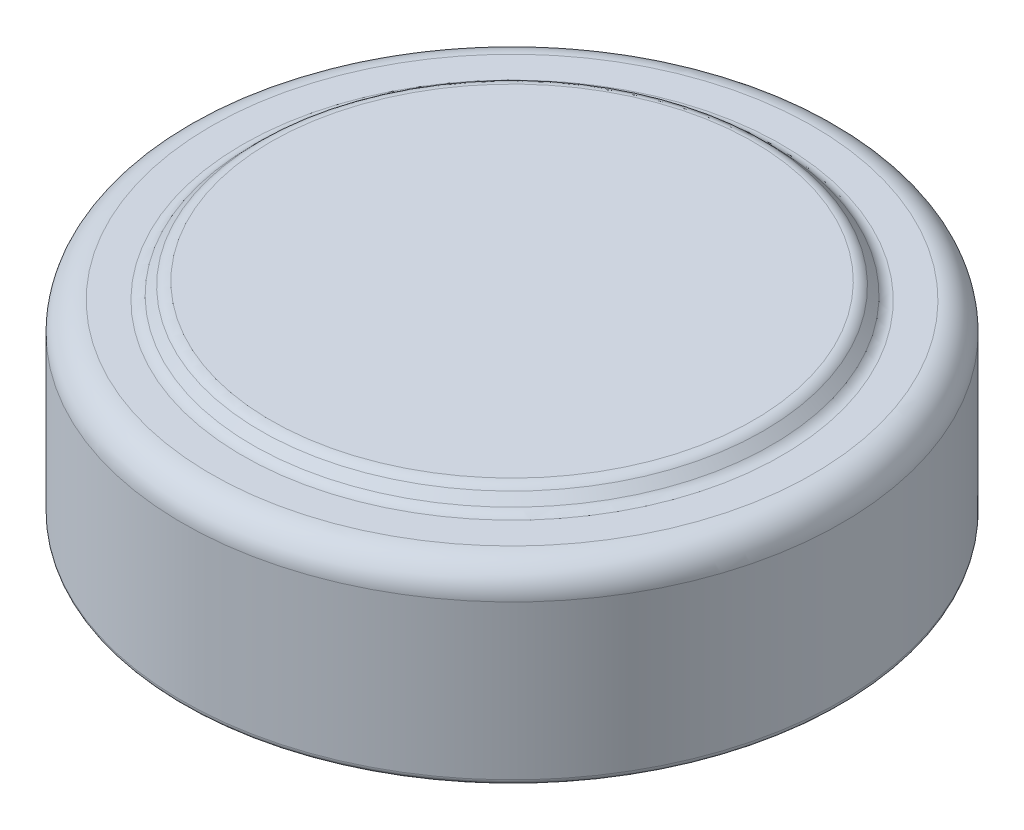
from build123d import *


with BuildPart() as part:
    # Sketch1 → Revolve1 (revolve)
    with BuildSketch(Plane.XY):
        with BuildLine():
            Line((0, 0), (-5.7, 0))
            ThreePointArc((-5.7, 0), (-5.770710678, 0.029289322), (-5.8, 0.1))
            Line((-5.8, 0.1), (-5.8, 2.81))
            ThreePointArc((-5.8, 2.81), (-5.653553391, 3.163553391), (-5.3, 3.31))
            Line((-5.3, 3.31), (-4.743553391, 3.31))
            ThreePointArc((-4.743553391, 3.31), (-4.647882533, 3.329030117), (-4.566776695, 3.383223305))
            Line((-4.566776695, 3.383223305), (-4.423223305, 3.526776695))
            ThreePointArc((-4.423223305, 3.526776695), (-4.342117467, 3.580969883), (-4.246446609, 3.6))
            Line((-4.246446609, 3.6), (0, 3.6))
            Line((0, 3.6), (0, 0))
        make_face()
    revolve(axis=Axis((0, 3.6, 0), (0, -1, 0)))


solid = part.part
